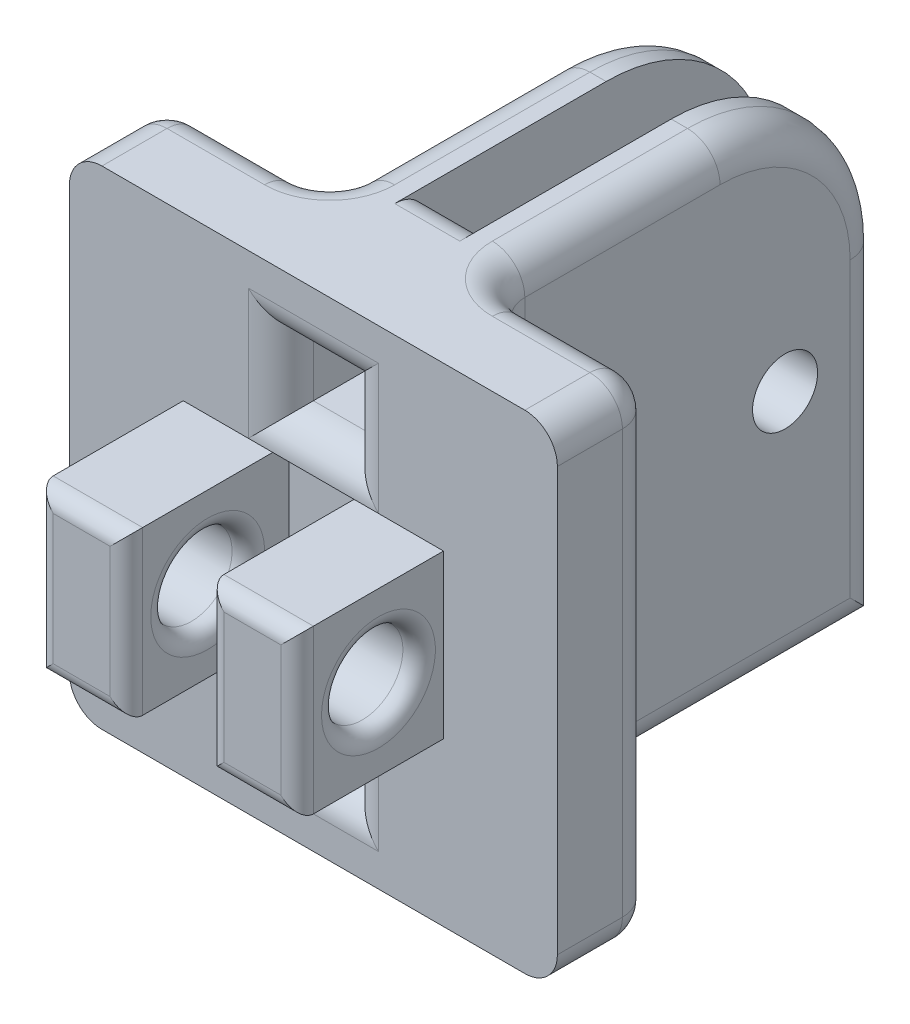
from build123d import *

# Parameters (mm, degrees)
BASE_SKETCH_W                        = 15
BASE_SKETCH_H                        = 15
BASE_SKETCH_EXTRUDE_DEPTH            = 20
NUB_CUTOUT_SKETCH_W                  = 5
NUB_CUTOUT_SKETCH_H                  = 15
NUB_EXTRUDED_CUT_DEPTH               = 12
HING_E_HOLE_SKETCH_R                 = 1
HINGE_HOLE_EXTRUDED_CUT_DEPTH        = 27.100766272
CORNER_FILLETS_R                     = 5
STYLE_FILLETS_R                      = 1
ROUTING_HOLES_SKETCH_W               = 2
ROUTING_HOLES_SKETCH_H               = 2
ROUTING_HOLES_EXTRUDED_CUT_DEPTH     = 23.638462845
TIE_DOWN_SKETCH_W                    = 4.5
TIE_DOWN_SKETCH_H                    = 5
TIE_DOWN_SKETCH_R                    = 1.25
TIE_DOWN_EXTRUDE_DEPTH               = 4
TIE_DOWN_CUTOUT_SKETCH_W             = 2.5
TIE_DOWN_CUTOUT_SKETCH_H             = 5
TIE_DOWN_CUTOUT_EXTRUDED_CUT_DEPTH   = 5
TIE_DOWN_FILLETS_R                   = 0.5
ROUTING_EXTENSION_SKETCH_W           = 2
ROUTING_EXTENSION_SKETCH_H           = 9.5
ROUTING_EXTENSION_EXTRUDED_CUT_DEPTH = 4
ROUTING_FILLETS_R                    = 1


with BuildPart() as part:
    # Base Sketch → Base Sketch Extrude (new body)
    with BuildSketch(Plane.XY):
        Rectangle(BASE_SKETCH_W, BASE_SKETCH_H)
    extrude(amount=BASE_SKETCH_EXTRUDE_DEPTH)

    # Nub Cutout Sketch → Nub Extruded Cut (cut)
    with BuildSketch(Plane.XY):
        with Locations((5, 0)):
            Rectangle(NUB_CUTOUT_SKETCH_W, NUB_CUTOUT_SKETCH_H)
        with Locations((-5, 0)):
            Rectangle(NUB_CUTOUT_SKETCH_W, NUB_CUTOUT_SKETCH_H)
    extrude(amount=NUB_EXTRUDED_CUT_DEPTH, mode=Mode.SUBTRACT)

    # Hing e Hole Sketch → Hinge Hole Extruded Cut (cut, through all)
    with BuildSketch(Plane(origin=(7.5, 0, 0), x_dir=(0, 0, -1), z_dir=(1, 0, 0))):
        with Locations(Location((-3, 0, 0), (0, 0, 90))):
            Circle(HING_E_HOLE_SKETCH_R)
    extrude(amount=-HINGE_HOLE_EXTRUDED_CUT_DEPTH, mode=Mode.SUBTRACT)

    # Corner Fillets
    corner_fillets_edges = [part.edges().sort_by_distance(p)[0] for p in [
        (0, 7.5, 0),
        (0, -7.5, 20),
        (0, 7.5, 20),
    ]]
    fillet(corner_fillets_edges, radius=CORNER_FILLETS_R)

    # Style Fillets
    style_fillets_edges = [part.edges().sort_by_distance(p)[0] for p in [
        (2.5, 7.5, 8.5),
        (2.5, -7.5, 6),
        (2.5, 0, 12),
        (5, -7.5, 12),
        (7.5, 0, 12),
        (5, 7.5, 12),
        (-2.5, -2.5, 0),
        (-2.5, -7.5, 6),
        (-2.5, 7.5, 8.5),
        (-2.5, 0, 12),
        (-5, 7.5, 12),
        (-7.5, 0, 12),
        (-5, -7.5, 12),
        (7.5, 0, 20),
        (-7.5, 0, 20),
        (7.5, -7.5, 13.5),
        (7.5, 7.5, 13.5),
        (7.5, 6.035533906, 18.535533906),
        (7.5, -6.035533906, 18.535533906),
        (-7.5, -7.5, 13.5),
        (-7.5, 7.5, 13.5),
        (-7.5, 6.035533906, 18.535533906),
        (-7.5, -6.035533906, 18.535533906),
        (-2.5, 6.035533906, 1.464466094),
        (2.5, -2.5, 0),
        (2.5, 6.035533906, 1.464466094),
    ]]
    fillet(style_fillets_edges, radius=STYLE_FILLETS_R)

    # Routing Holes Sketch → Routing Holes EXtruded Cut (cut, through all)
    with BuildSketch(Plane.XY):
        with Locations((0, 4.5)):
            Rectangle(ROUTING_HOLES_SKETCH_W, ROUTING_HOLES_SKETCH_H)
        with Locations((0, -4.5)):
            Rectangle(ROUTING_HOLES_SKETCH_W, ROUTING_HOLES_SKETCH_H)
    extrude(amount=ROUTING_HOLES_EXTRUDED_CUT_DEPTH, mode=Mode.SUBTRACT)

    # Split1
    split(bisect_by=Plane.XY.offset(15), keep=Keep.BOTTOM)

    # Tie Down Sketch → Tie Down Extrude (add, symmetric)
    with BuildSketch(Plane(origin=(0, 0, 0), x_dir=(0, 0, -1), z_dir=(1, 0, 0))):
        with Locations((-17.25, 0)):
            Rectangle(TIE_DOWN_SKETCH_W, TIE_DOWN_SKETCH_H)
        with Locations((-17, 0)):
            Circle(TIE_DOWN_SKETCH_R, mode=Mode.SUBTRACT)
    extrude(amount=TIE_DOWN_EXTRUDE_DEPTH, both=True)

    # Tie Down Cutout Sketch → Tie Down Cutout Extruded Cut (cut)
    with BuildSketch(Plane.XY.offset(19.5)):
        Rectangle(TIE_DOWN_CUTOUT_SKETCH_W, TIE_DOWN_CUTOUT_SKETCH_H)
    extrude(amount=-TIE_DOWN_CUTOUT_EXTRUDED_CUT_DEPTH, mode=Mode.SUBTRACT)

    # Tie Down Fillets
    tie_down_fillets_edges = [part.edges().sort_by_distance(p)[0] for p in [
        (-2.625, 2.5, 19.5),
        (-1.25, 0, 18.25),
        (1.25, 0, 18.25),
        (-1.25, 0, 19.5),
        (1.25, 0, 19.5),
        (4, 0, 19.5),
        (-4, 0, 18.25),
        (-4, 0, 19.5),
        (2.625, 2.5, 19.5),
        (2.625, -2.5, 19.5),
        (4, 0, 18.25),
        (-2.625, -2.5, 19.5),
    ]]
    fillet(tie_down_fillets_edges, radius=TIE_DOWN_FILLETS_R)

    # Routing Extension Sketch → Routing Extension Extruded Cut (cut)
    with BuildSketch(Plane(origin=(0, 7.5, 0), x_dir=(1, 0, 0), z_dir=(0, 1, 0))):
        with Locations((0, -5.75)):
            Rectangle(ROUTING_EXTENSION_SKETCH_W, ROUTING_EXTENSION_SKETCH_H)
    extrude(amount=-ROUTING_EXTENSION_EXTRUDED_CUT_DEPTH, mode=Mode.SUBTRACT)

    # Routing Fillets
    routing_fillets_edges = [part.edges().sort_by_distance(p)[0] for p in [
        (0, 7.5, 10.5),
        (0, -3.5, 0),
        (0, -5.5, 0),
        (0, 3.5, 0.101020514),
        (-1, -4.5, 15),
        (0, -3.5, 15),
        (1, -4.5, 15),
        (0, -5.5, 15),
        (0, 5.5, 15),
        (1, 4.5, 15),
        (0, 3.5, 15),
        (-1, 4.5, 15),
    ]]
    fillet(routing_fillets_edges, radius=ROUTING_FILLETS_R - 0.0001)  # a hair under: the kernel refuses the full size


solid = part.part
